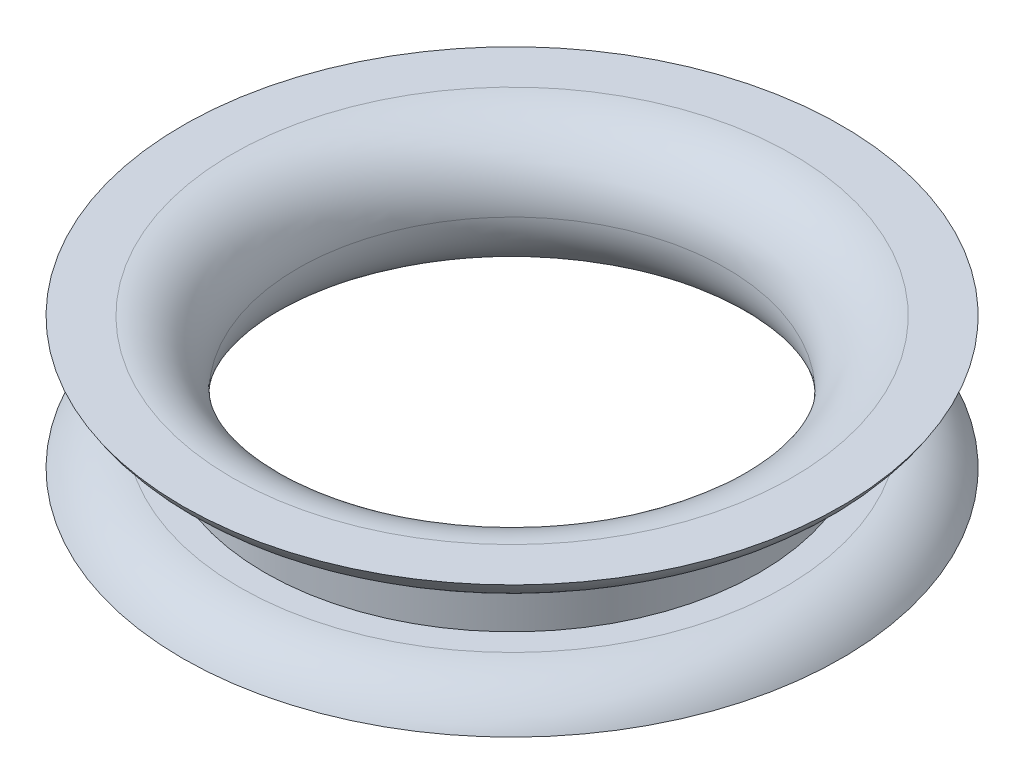
from build123d import *

# Parameters (mm, degrees)
SKETCH1_R           = 12.7
BOSS_EXTRUDE1_DEPTH = 1.27
SKETCH2_R           = 9.525
BOSS_EXTRUDE2_DEPTH = 2.54
SKETCH3_R           = 12.7
BOSS_EXTRUDE3_DEPTH = 1.27
SHELL1_OUTLINE_R    = 8.255
SHELL1_DEPTH        = 5.08
FILLET1_R           = 2.54
FILLET2_R           = 2.54


# Read off the part's stored shape, not the designer's step: Shell1
# Some blends are built 0.0001 mm under size
with BuildPart() as part:
    # Sketch1 → Boss-Extrude1 (new body)
    with BuildSketch(Plane(origin=(0, 0, 0), x_dir=(1, 0, 0), z_dir=(0, 1, 0))):
        with Locations(Location((0, 0, 0), (0, 0, 270))):
            Circle(SKETCH1_R)
    extrude(amount=BOSS_EXTRUDE1_DEPTH)

    # Sketch2 → Boss-Extrude2 (add)
    with BuildSketch(Plane(origin=(0, 1.27, 0), x_dir=(1, 0, 0), z_dir=(0, 1, 0))):
        with Locations(Location((0, 0, 0), (0, 0, 270))):
            Circle(SKETCH2_R)
    extrude(amount=BOSS_EXTRUDE2_DEPTH)

    # Sketch3 → Boss-Extrude3 (add)
    with BuildSketch(Plane(origin=(0, 3.81, 0), x_dir=(1, 0, 0), z_dir=(0, 1, 0))):
        with Locations(Location((0, 0, 0), (0, 0, 270))):
            Circle(SKETCH3_R)
    extrude(amount=BOSS_EXTRUDE3_DEPTH)

    # Shell1 outline → Shell1 (cut)
    with BuildSketch(Plane(origin=(0, 0, 0), x_dir=(1, 0, 0), z_dir=(0, 1, 0))):
        Circle(SHELL1_OUTLINE_R)
    extrude(amount=SHELL1_DEPTH, mode=Mode.SUBTRACT)

    # Fillet1
    # the kernel refuses this fillet: 2.54 mm, written as the material it takes off along each edge
    with BuildSketch(Plane(origin=(0, 1.27, 0), x_dir=(0, 0, 1), z_dir=(-1, 0, 0))) as fillet1_piece_1:
        with BuildLine():
            CenterArc((10.500295474, -2.54), FILLET1_R, 30, 60)
            Line((12.7, -1.27), (12.743994091, -1.2446))
            ThreePointArc((12.743994091, -1.2446), (12.7508, -0.635), (12.7508, 0))
            Line((12.7508, 0), (12.7, 0.0508))
            Line((12.7, 0.0508), (10.500295474, 0.0508))
            Line((10.500295474, 0.0508), (10.500295474, 0))
        make_face()
    revolve(axis=Axis((0, 1.27, 0), (0, 1, 0)), mode=Mode.SUBTRACT)
    with BuildSketch(Plane(origin=(0, 3.81, 0), x_dir=(0, 0, 1), z_dir=(-1, 0, 0))) as fillet1_piece_2:
        with BuildLine():
            CenterArc((10.500295474, 2.54), FILLET1_R, 270, 60)
            Line((10.500295474, 0), (10.500295474, -0.0508))
            Line((10.500295474, -0.0508), (12.7, -0.0508))
            Line((12.7, -0.0508), (12.7508, 0))
            ThreePointArc((12.7508, 0), (12.7508, 0.635), (12.743994091, 1.2446))
            Line((12.743994091, 1.2446), (12.7, 1.27))
        make_face()
    revolve(axis=Axis((0, 3.81, 0), (0, 1, 0)), mode=Mode.SUBTRACT)

    # Fillet2
    fillet2_edges = [part.edges().sort_by_distance(p)[0] for p in [
        (-8.255, 5.08, 0),
        (-8.255, 0, 0),
    ]]
    fillet(fillet2_edges, radius=FILLET2_R - 0.0001)  # a hair under: the kernel refuses the full size


solid = part.part
